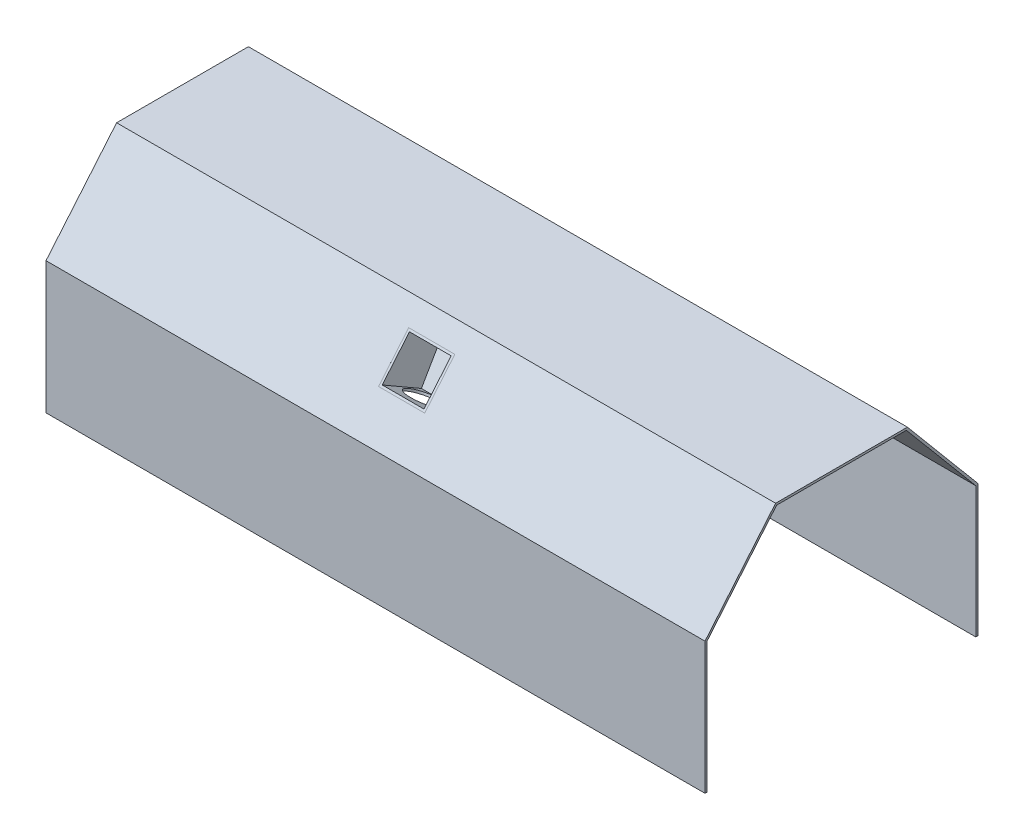
from build123d import *

# Parameters (mm, degrees)
SKETCH_1_W          = 300
SKETCH_1_H          = 60
EXTRUDE_1_DEPTH     = 1
SKETCH_4_W          = 300
SKETCH_4_H          = 1.002930946
EXTRUDE_2_DEPTH     = 50
SKETCH_5_W          = 300
SKETCH_5_H          = 1.001378412
EXTRUDE_3_DEPTH     = 60
SKETCH_11_W         = 21
SKETCH_11_H         = 21
EXTRUDE_5_DEPTH     = 25
SHELL_START         = -9.5
SHELL_1_DEPTH       = 19
SHELL_START_2       = -10.5
SHELL_1_2_DEPTH     = 21
SKETCH_12_R         = 8.5
CUT_EXTRUDE_4_DEPTH = 1


# Read off the part's stored shape, not the designer's step: 抽壳1
with BuildPart() as part:
    # 草图1 → 凸台-拉伸1 (new body)
    with BuildSketch(Plane.XY):
        with Locations((0, 30)):
            Rectangle(SKETCH_1_W, SKETCH_1_H)
    extrude_1 = extrude(amount=-EXTRUDE_1_DEPTH)

    # 草图4 → 凸台-拉伸2 (add)
    with BuildSketch(Plane(origin=(0, 35.20944533, -29.54423259), x_dir=(-1, 0, 0), z_dir=(0, 0.7660444431189771, -0.6427876096865406))):
        with Locations((0, 38.065791108)):
            Rectangle(SKETCH_4_W, SKETCH_4_H)
    extrude_2 = extrude(amount=EXTRUDE_2_DEPTH)

    # 草图5 → 凸台-拉伸3 (add)
    with BuildSketch(Plane(origin=(0, 0, -32.139380484), x_dir=(-1, 0, 0), z_dir=(0, 0, -1))):
        with Locations((0, 97.80153295)):
            Rectangle(SKETCH_5_W, SKETCH_5_H)
    extrude(amount=EXTRUDE_3_DEPTH)

    # 镜向1: 凸台-拉伸2 across plane
    add(extrude_2.mirror(Plane.XY.offset(-62.139380484)))

    # 镜向2: 凸台-拉伸1 across plane
    add(extrude_1.mirror(Plane.XY.offset(-62.139380484)))

    # 草图11 → 凸台-拉伸5 (add)
    with BuildSketch(Plane(origin=(0, 15, 25.980762114), x_dir=(-1, 0, 0), z_dir=(0, 0.500000000000001, 0.8660254037844382))):
        with Locations((0, -80.701911878)):
            Rectangle(SKETCH_11_W, SKETCH_11_H)
    extrude(amount=-EXTRUDE_5_DEPTH)

    # 抽壳1 outline → 抽壳1 (cut)
    with BuildSketch(Plane.YZ.offset(SHELL_START)):
        Polygon((89.744253028, -24.962217823), (90.522114942, -25.614921468), (90.523603022, -25.612344038), (93.98317256, -19.620193825), (75.79663908, -9.120193825), (74.18850284, -11.9055675), (74.187014759, -11.90814493), (74.964876673, -12.560848575), (64.662664484, -30.404803516), (81.117147156, -39.904803516), align=None)
    extrude(amount=SHELL_1_DEPTH, mode=Mode.SUBTRACT)

    # Shell 1 2 outline → Shell 1 2 (cut)
    with BuildSketch(Plane.YZ.offset(SHELL_START_2)):
        Polygon((74.187014759, -11.90814493), (90.522114942, -25.614921468), (90.523603022, -25.612344038), (93.98317256, -19.620193825), (75.79663908, -9.120193825), (74.18850284, -11.9055675), align=None)
    extrude(amount=SHELL_1_2_DEPTH, mode=Mode.SUBTRACT)

    # 草图12 → 切除-拉伸4 (cut)
    with BuildSketch(Plane(origin=(0, 60.79663908, -35.100955939), x_dir=(1, 0, 0), z_dir=(0, -0.8660254037844382, 0.5000000000000011))):
        with Locations(Location((0, 14, 0), (0, 0, 270))):
            Circle(SKETCH_12_R)
    extrude(amount=-CUT_EXTRUDE_4_DEPTH, mode=Mode.SUBTRACT)


solid = part.part
